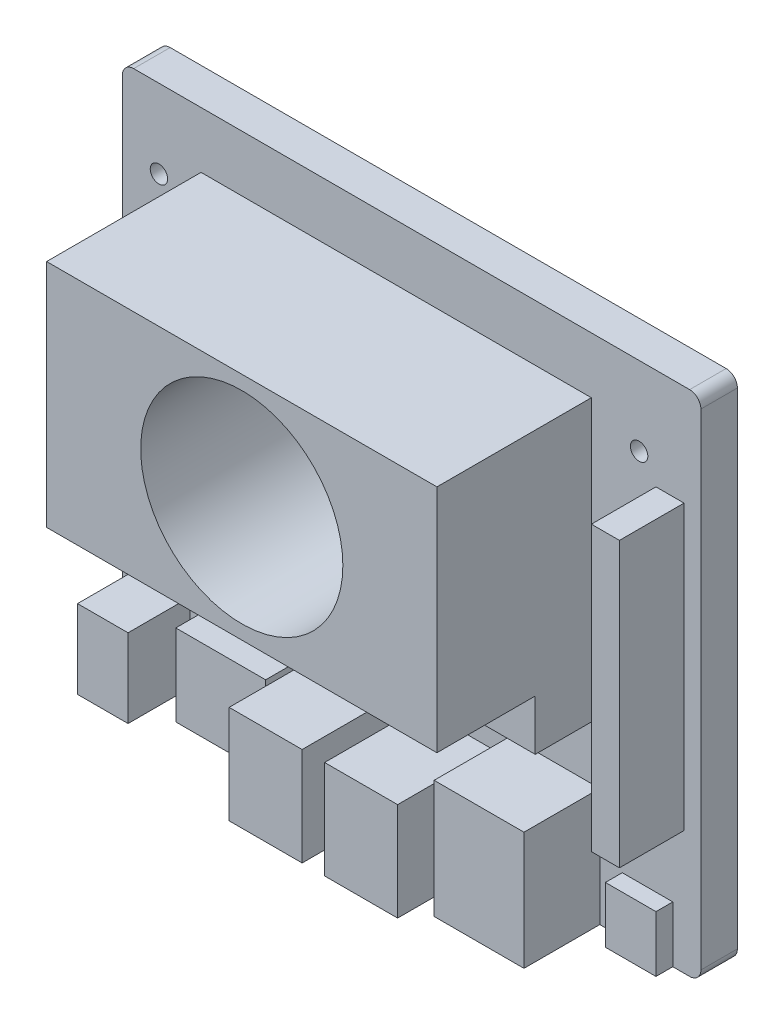
from build123d import *

# Parameters (mm, degrees)
SKETCH_1_W          = 103
SKETCH_1_H          = 90.5
EXTRUDE_1_DEPTH     = 6.5
SKETCH_2_W          = 9
SKETCH_2_H          = 14
SKETCH_2_W_2        = 16
SKETCH_2_H_2        = 14.5
SKETCH_2_W_3        = 13
SKETCH_2_H_3        = 17.5
SKETCH_2_H_4        = 21
SKETCH_2_H_5        = 10
SKETCH_2_W_4        = 69.5
SKETCH_2_H_6        = 50
SKETCH_2_R          = 18
SKETCH_2_W_5        = 2.5
SKETCH_2_H_7        = 19
SKETCH_2_W_6        = 5
SKETCH_2_H_8        = 50.5
EXTRUDE_2_DEPTH     = 27.5
CUT_EXTRUDE_1_REACH = 143.263
SKETCH_3_W          = 9
SKETCH_3_H          = 16.5
SKETCH_3_W_2        = 16
SKETCH_3_H_2        = 21
SKETCH_3_W_3        = 13
SKETCH_3_H_3        = 10.5
SKETCH_3_H_4        = 14
SKETCH_3_H_5        = 24.5
SKETCH_4_W          = 69.5
SKETCH_4_H          = 9
CUT_EXTRUDE_2_DEPTH = 17.5
SKETCH_5_R          = 1.55
CUT_EXTRUDE_3_DEPTH = 140.840981118
CUT_EXTRUDE_4_REACH = 135.8
SKETCH_6_W          = 21
SKETCH_6_H          = 19
CUT_EXTRUDE_5_REACH = 141.091
SKETCH_7_W          = 16
SKETCH_7_H          = 50.5
FILLET_1_R          = 2


with BuildPart() as part:
    # 草图1 → 凸台-拉伸1 (new body)
    with BuildSketch(Plane.XY):
        with Locations((51.5, 45.25)):
            Rectangle(SKETCH_1_W, SKETCH_1_H)
    extrude(amount=EXTRUDE_1_DEPTH)

    # 草图2 → 凸台-拉伸2 (add)
    # profile 1 of 9: a face of its own
    with BuildSketch(Plane.XY.offset(6.5)):
        with Locations((7.5, 7)):
            Rectangle(SKETCH_2_W, SKETCH_2_H)
    # profile 2 of 9: a face of its own
    with BuildSketch(Plane.XY.offset(6.5)):
        with Locations((24, 7.25)):
            Rectangle(SKETCH_2_W_2, SKETCH_2_H_2)
    # profile 3 of 9: a face of its own
    with BuildSketch(Plane.XY.offset(6.5)):
        with Locations((42.5, 8.75)):
            Rectangle(SKETCH_2_W_3, SKETCH_2_H_3)
    # profile 4 of 9: a face of its own
    with BuildSketch(Plane.XY.offset(6.5)):
        with Locations((59.5, 8.75)):
            Rectangle(SKETCH_2_W_3, SKETCH_2_H_3)
    # profile 5 of 9: a face of its own
    with BuildSketch(Plane.XY.offset(6.5)):
        with Locations((77, 10.5)):
            Rectangle(SKETCH_2_W_2, SKETCH_2_H_4)
    # profile 6 of 9: a face of its own
    with BuildSketch(Plane.XY.offset(6.5)):
        with Locations((93.5, 5)):
            Rectangle(SKETCH_2_W, SKETCH_2_H_5)
    # profile 7 of 9: a face of its own
    with BuildSketch(Plane.XY.offset(6.5)):
        with Locations((48.75, 55.5)):
            Rectangle(SKETCH_2_W_4, SKETCH_2_H_6)
        with Locations((48.75, 60)):
            Circle(SKETCH_2_R, mode=Mode.SUBTRACT)
    # profile 8 of 9: a face of its own
    with BuildSketch(Plane.XY.offset(6.5)):
        with Locations((91.25, 58)):
            Rectangle(SKETCH_2_W_5, SKETCH_2_H_7)
    # profile 9 of 9: a face of its own
    with BuildSketch(Plane.XY.offset(6.5)):
        with Locations((97.5, 47.25)):
            Rectangle(SKETCH_2_W_6, SKETCH_2_H_8)
    extrude(amount=EXTRUDE_2_DEPTH)

    # 草图3 → 切除-拉伸1 (cut, up to next)
    with BuildSketch(Plane.XZ, mode=Mode.PRIVATE) as cut_extrude_1_sk1:
        with Locations((7.5, 25.75)):
            Rectangle(SKETCH_3_W, SKETCH_3_H)
    cut_extrude_1_tool1 = extrude(cut_extrude_1_sk1.sketch, amount=-CUT_EXTRUDE_1_REACH, mode=Mode.PRIVATE) & part.part
    # 草图3 → 切除-拉伸1 (cut, up to next)
    with BuildSketch(Plane.XZ, mode=Mode.PRIVATE) as cut_extrude_1_sk2:
        with Locations((24, 23.5)):
            Rectangle(SKETCH_3_W_2, SKETCH_3_H_2)
    cut_extrude_1_tool2 = extrude(cut_extrude_1_sk2.sketch, amount=-CUT_EXTRUDE_1_REACH, mode=Mode.PRIVATE) & part.part
    # 草图3 → 切除-拉伸1 (cut, up to next)
    with BuildSketch(Plane.XZ, mode=Mode.PRIVATE) as cut_extrude_1_sk3:
        with Locations((42.5, 28.75)):
            Rectangle(SKETCH_3_W_3, SKETCH_3_H_3)
    cut_extrude_1_tool3 = extrude(cut_extrude_1_sk3.sketch, amount=-CUT_EXTRUDE_1_REACH, mode=Mode.PRIVATE) & part.part
    # 草图3 → 切除-拉伸1 (cut, up to next)
    with BuildSketch(Plane.XZ, mode=Mode.PRIVATE) as cut_extrude_1_sk4:
        with Locations((59.5, 28.75)):
            Rectangle(SKETCH_3_W_3, SKETCH_3_H_3)
    cut_extrude_1_tool4 = extrude(cut_extrude_1_sk4.sketch, amount=-CUT_EXTRUDE_1_REACH, mode=Mode.PRIVATE) & part.part
    # 草图3 → 切除-拉伸1 (cut, up to next)
    with BuildSketch(Plane.XZ, mode=Mode.PRIVATE) as cut_extrude_1_sk5:
        with Locations((77, 27)):
            Rectangle(SKETCH_3_W_2, SKETCH_3_H_4)
    cut_extrude_1_tool5 = extrude(cut_extrude_1_sk5.sketch, amount=-CUT_EXTRUDE_1_REACH, mode=Mode.PRIVATE) & part.part
    # 草图3 → 切除-拉伸1 (cut, up to next)
    with BuildSketch(Plane.XZ, mode=Mode.PRIVATE) as cut_extrude_1_sk6:
        with Locations((93.5, 21.75)):
            Rectangle(SKETCH_3_W, SKETCH_3_H_5)
    cut_extrude_1_tool6 = extrude(cut_extrude_1_sk6.sketch, amount=-CUT_EXTRUDE_1_REACH, mode=Mode.PRIVATE) & part.part
    add(cut_extrude_1_tool1.solids().sort_by_distance((7.5, 0, 25.75))[0], mode=Mode.SUBTRACT)
    add(cut_extrude_1_tool2.solids().sort_by_distance((24, 0, 23.5))[0], mode=Mode.SUBTRACT)
    add(cut_extrude_1_tool3.solids().sort_by_distance((42.5, 0, 28.75))[0], mode=Mode.SUBTRACT)
    add(cut_extrude_1_tool4.solids().sort_by_distance((59.5, 0, 28.75))[0], mode=Mode.SUBTRACT)
    add(cut_extrude_1_tool5.solids().sort_by_distance((77, 0, 27))[0], mode=Mode.SUBTRACT)
    add(cut_extrude_1_tool6.solids().sort_by_distance((93.5, 0, 21.75))[0], mode=Mode.SUBTRACT)

    # 草图4 → 切除-拉伸2 (cut)
    with BuildSketch(Plane.XY.offset(34)):
        with Locations((48.75, 35)):
            Rectangle(SKETCH_4_W, SKETCH_4_H)
    extrude(amount=-CUT_EXTRUDE_2_DEPTH, mode=Mode.SUBTRACT)

    # 草图5 → 切除-拉伸3 (cut, through all)
    with BuildSketch(Plane.XY.offset(6.5)):
        with Locations((92, 19)):
            Circle(SKETCH_5_R)
        with Locations((92, 76.5)):
            Circle(SKETCH_5_R)
        with Locations((6.5, 76.5)):
            Circle(SKETCH_5_R)
        with Locations((6.5, 19.5)):
            Circle(SKETCH_5_R)
    extrude(amount=-CUT_EXTRUDE_3_DEPTH, mode=Mode.SUBTRACT)

    # 草图6 → 切除-拉伸4 (cut, up to next)
    with BuildSketch(Plane(origin=(92.5, 0, 0), x_dir=(0, 0, -1), z_dir=(1, 0, 0)), mode=Mode.PRIVATE) as cut_extrude_4_sk1:
        with Locations((-23.5, 58)):
            Rectangle(SKETCH_6_W, SKETCH_6_H)
    cut_extrude_4_tool1 = extrude(cut_extrude_4_sk1.sketch, amount=-CUT_EXTRUDE_4_REACH, mode=Mode.PRIVATE) & part.part
    add(cut_extrude_4_tool1.solids().sort_by_distance((92.5, 58, 23.5))[0], mode=Mode.SUBTRACT)

    # 草图7 → 切除-拉伸5 (cut, up to next)
    with BuildSketch(Plane(origin=(100, 0, 0), x_dir=(0, 0, -1), z_dir=(1, 0, 0)), mode=Mode.PRIVATE) as cut_extrude_5_sk1:
        with Locations((-26, 47.25)):
            Rectangle(SKETCH_7_W, SKETCH_7_H)
    cut_extrude_5_tool1 = extrude(cut_extrude_5_sk1.sketch, amount=-CUT_EXTRUDE_5_REACH, mode=Mode.PRIVATE) & part.part
    add(cut_extrude_5_tool1.solids().sort_by_distance((100, 47.25, 26))[0], mode=Mode.SUBTRACT)

    # 圆角1
    fillet_1_edges = [part.edges().sort_by_distance(p)[0] for p in [
        (0, 0, 3.25),
        (0, 90.5, 3.25),
        (103, 0, 3.25),
        (103, 90.5, 3.25),
    ]]
    fillet(fillet_1_edges, radius=FILLET_1_R)


solid = part.part
